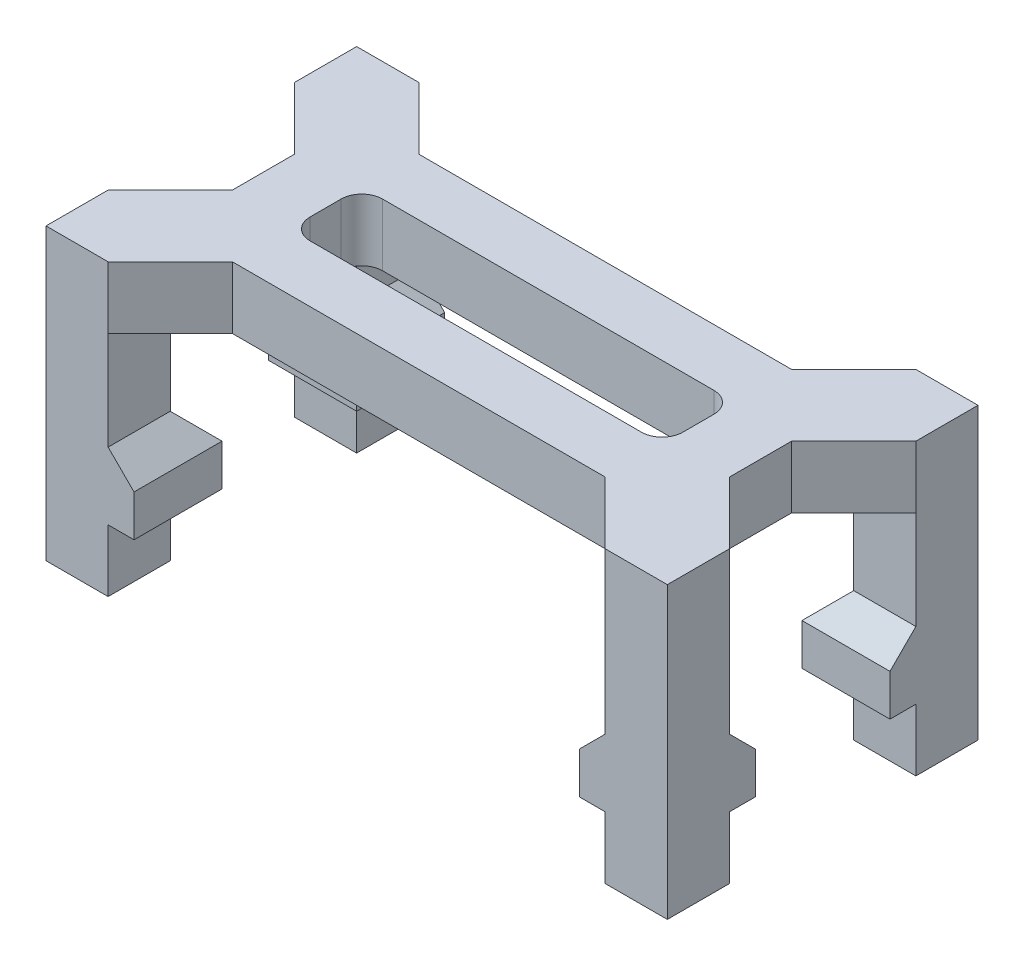
from build123d import *

# Parameters (mm, degrees)
SKETCH1_W             = 3
SKETCH1_H             = 3
BOSS_EXTRUDE1_DEPTH   = 8
BOSS_EXTRUDE1_2_DEPTH = 8
BOSS_EXTRUDE1_3_DEPTH = 8
BOSS_EXTRUDE1_4_DEPTH = 8
SKETCH2_W             = 30
SKETCH2_H             = 15
BOSS_EXTRUDE2_DEPTH   = 3
CUT_EXTRUDE1_DEPTH    = 21.05617112
CUT_EXTRUDE2_DEPTH    = 21.05617112
BOSS_EXTRUDE3_DEPTH   = 2
CHAMFER1_SIZE         = 1.25
SKETCH7_W             = 3
SKETCH7_H             = 3
BOSS_EXTRUDE4_DEPTH   = 3


with BuildPart() as part:
    # Sketch1 → Boss-Extrude1 (new body)
    with BuildSketch(Plane(origin=(0, 0, 0), x_dir=(1, 0, 0), z_dir=(0, 1, 0))):
        with Locations((-13.5, 6)):
            Rectangle(SKETCH1_W, SKETCH1_H)
    extrude(amount=BOSS_EXTRUDE1_DEPTH)



with BuildPart() as body_2:
    # Sketch1 → Boss-Extrude1 2 (new body)
    with BuildSketch(Plane(origin=(0, 0, 0), x_dir=(1, 0, 0), z_dir=(0, 1, 0))):
        with Locations((13.5, 6)):
            Rectangle(SKETCH1_W, SKETCH1_H)
    extrude(amount=BOSS_EXTRUDE1_2_DEPTH)


with BuildPart() as body_3:
    # Sketch1 → Boss-Extrude1 3 (new body)
    with BuildSketch(Plane(origin=(0, 0, 0), x_dir=(1, 0, 0), z_dir=(0, 1, 0))):
        with Locations((13.5, -6)):
            Rectangle(SKETCH1_W, SKETCH1_H)
    extrude(amount=BOSS_EXTRUDE1_3_DEPTH)


with BuildPart() as body_4:
    # Sketch1 → Boss-Extrude1 4 (new body)
    with BuildSketch(Plane(origin=(0, 0, 0), x_dir=(1, 0, 0), z_dir=(0, 1, 0))):
        with Locations((-13.5, -6)):
            Rectangle(SKETCH1_W, SKETCH1_H)
    extrude(amount=BOSS_EXTRUDE1_4_DEPTH)


with BuildPart() as part_1:
    add(part.part)

    add(body_2.part)  # Boss-Extrude2 merges body 2

    add(body_3.part)  # Boss-Extrude2 merges body 3

    add(body_4.part)  # Boss-Extrude2 merges body 4
    # Sketch2 → Boss-Extrude2 (add)
    with BuildSketch(Plane(origin=(0, 8, 0), x_dir=(1, 0, 0), z_dir=(0, 1, 0))):
        Rectangle(SKETCH2_W, SKETCH2_H)
    extrude(amount=BOSS_EXTRUDE2_DEPTH)

    # Sketch3 → Cut-Extrude1 (cut, through all)
    with BuildSketch(Plane(origin=(0, 11, 0), x_dir=(1, 0, 0), z_dir=(0, 1, 0))):
        Polygon((-12, 7.5), (-9, 4.5), (9, 4.5), (12, 7.5), align=None)
        Polygon((-12, -7.5), (-9, -4.5), (9, -4.5), (12, -7.5), align=None)
        Polygon((-15, 4.5), (-12, 1.5), (-12, -1.5), (-15, -4.5), align=None)
        Polygon((15, 4.5), (12, 1.5), (12, -1.5), (15, -4.5), align=None)
    extrude(amount=-CUT_EXTRUDE1_DEPTH, mode=Mode.SUBTRACT)

    # Sketch4 → Cut-Extrude2 (cut, through all)
    with BuildSketch(Plane(origin=(0, 11, 0), x_dir=(1, 0, 0), z_dir=(0, 1, 0))):
        with BuildLine():
            Line((-8, 1.75), (8, 1.75))
            ThreePointArc((8, 1.75), (8.707106781, 1.457106781), (9, 0.75))
            Line((9, 0.75), (9, -0.75))
            ThreePointArc((9, -0.75), (8.707106781, -1.457106781), (8, -1.75))
            Line((8, -1.75), (-8, -1.75))
            ThreePointArc((-8, -1.75), (-8.707106781, -1.457106781), (-9, -0.75))
            Line((-9, -0.75), (-9, 0.75))
            ThreePointArc((-9, 0.75), (-8.707106781, 1.457106781), (-8, 1.75))
        make_face()
    extrude(amount=-CUT_EXTRUDE2_DEPTH, mode=Mode.SUBTRACT)

    # Sketch6 → Boss-Extrude3 (add)
    with BuildSketch(Plane.XZ):
        Polygon((-10.75, 7.5), (-12, 7.5), (-12, 4.5), (-15, 4.5), (-15, 3.25), (-10.75, 3.25), align=None)
        Polygon((12, 4.5), (12, 7.5), (10.75, 7.5), (10.75, 3.25), (15, 3.25), (15, 4.5), align=None)
        Polygon((10.75, -7.5), (12, -7.5), (12, -4.5), (15, -4.5), (15, -3.25), (10.75, -3.25), align=None)
        Polygon((-12, -4.5), (-12, -7.5), (-10.75, -7.5), (-10.75, -3.25), (-15, -3.25), (-15, -4.5), align=None)
    extrude(amount=-BOSS_EXTRUDE3_DEPTH)

    # Chamfer1
    chamfer1_edges = [part_1.edges().sort_by_distance(p)[0] for p in [
        (-12, 2, 6),
        (-13.5, 2, 4.5),
        (-13.5, 2, -4.5),
        (-12, 2, -6),
        (12, 2, 6),
        (13.5, 2, 4.5),
        (12, 2, -6),
        (13.5, 2, -4.5),
    ]]
    chamfer(chamfer1_edges, length=CHAMFER1_SIZE - 0.0001)  # a hair under: the kernel refuses the full size

    # Sketch7 → Boss-Extrude4 (add)
    with BuildSketch(Plane.XZ):
        with Locations((-13.5, 6)):
            Rectangle(SKETCH7_W, SKETCH7_H)
        with Locations((-13.5, -6)):
            Rectangle(SKETCH7_W, SKETCH7_H)
        with Locations((13.5, -6)):
            Rectangle(SKETCH7_W, SKETCH7_H)
        with Locations((13.5, 6)):
            Rectangle(SKETCH7_W, SKETCH7_H)
    extrude(amount=BOSS_EXTRUDE4_DEPTH)


solid = part_1.part
